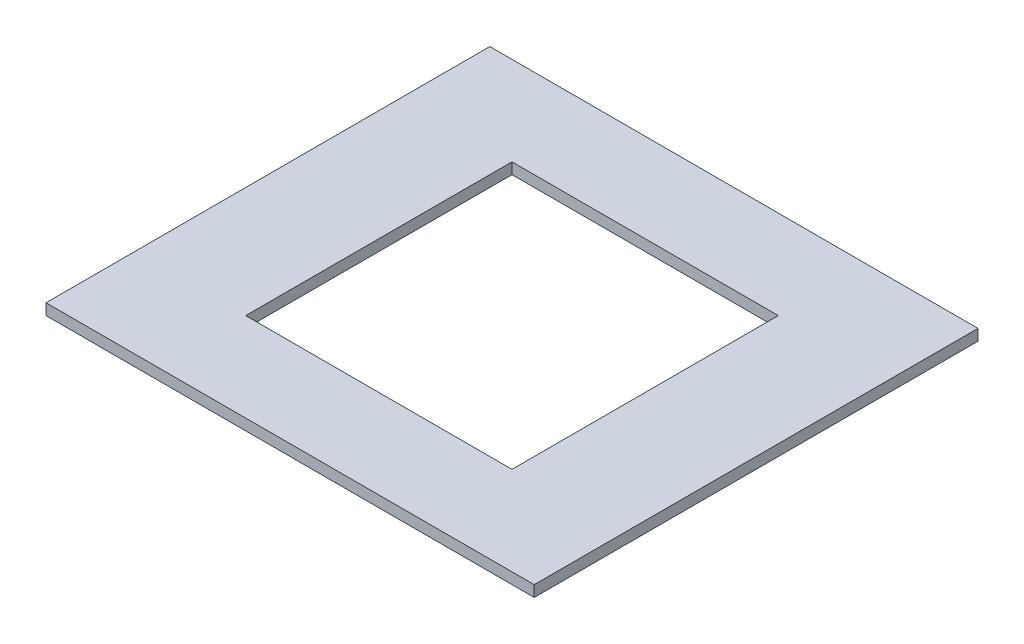
from build123d import *

# Parameters (mm, degrees)
SKETCH1_W           = 139.7
SKETCH1_H           = 127
SKETCH1_W_2         = 76.2
SKETCH1_H_2         = 76.2
BOSS_EXTRUDE1_DEPTH = 3.175


with BuildPart() as part:
    # Sketch1 → Boss-Extrude1 (new body)
    with BuildSketch(Plane(origin=(0, 0, 0), x_dir=(1, 0, 0), z_dir=(0, 1, 0))):
        with Locations((-69.85, 63.5)):
            Rectangle(SKETCH1_W, SKETCH1_H)
        with Locations((-69.85, 63.5)):
            Rectangle(SKETCH1_W_2, SKETCH1_H_2, mode=Mode.SUBTRACT)
    extrude(amount=BOSS_EXTRUDE1_DEPTH)


solid = part.part
